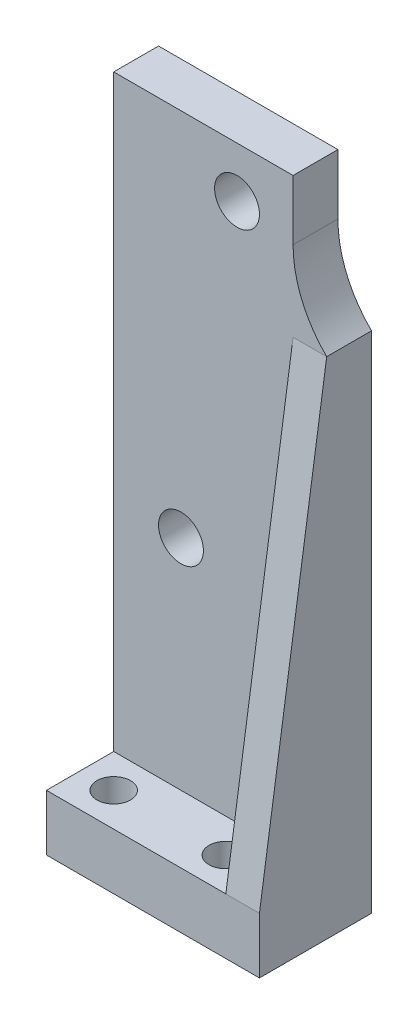
from build123d import *

# Parameters (mm, degrees)
SKETCH_1_W          = 16
SKETCH_1_H          = 6
SKETCH_1_R          = 1.5
EXTRUDE_1_DEPTH     = 5
SKETCH_2_W          = 16
SKETCH_2_H          = 57.5
EXTRUDE_2_DEPTH     = 4
SKETCH_3_R          = 2
CUT_EXTRUDE_1_DEPTH = 60.213596412
SKETCH_4_R          = 2
CUT_EXTRUDE_2_DEPTH = 60.213596412
SKETCH_5_R          = 3.5
CUT_EXTRUDE_3_DEPTH = 1
EXTRUDE_3_DEPTH     = 3
FILLET_1_R          = 10


with BuildPart() as part:
    # 草图1 → 凸台-拉伸1 (new body)
    with BuildSketch(Plane(origin=(0, 0, 0), x_dir=(1, 0, 0), z_dir=(0, 1, 0))):
        with Locations((2, 0)):
            Rectangle(SKETCH_1_W, SKETCH_1_H)
        with Locations(Location((-3, 0, 0), (0, 0, 270))):
            Circle(SKETCH_1_R, mode=Mode.SUBTRACT)
        with Locations(Location((7, 0, 0), (0, 0, 270))):
            Circle(SKETCH_1_R, mode=Mode.SUBTRACT)
    extrude(amount=EXTRUDE_1_DEPTH)

    # 草图2 → 凸台-拉伸2 (add)
    with BuildSketch(Plane(origin=(0, 0, -3), x_dir=(-1, 0, 0), z_dir=(0, 0, -1))):
        with Locations((-2, 28.75)):
            Rectangle(SKETCH_2_W, SKETCH_2_H)
    extrude(amount=EXTRUDE_2_DEPTH)

    # 草图3 → 切除-拉伸1 (cut, through all)
    with BuildSketch(Plane(origin=(0, 0, -7), x_dir=(-1, 0, 0), z_dir=(0, 0, -1))):
        with Locations((-5, 53)):
            Circle(SKETCH_3_R)
    extrude(amount=-CUT_EXTRUDE_1_DEPTH, mode=Mode.SUBTRACT)

    # 草图4 → 切除-拉伸2 (cut, through all)
    with BuildSketch(Plane(origin=(0, 0, -7), x_dir=(-1, 0, 0), z_dir=(0, 0, -1))):
        with Locations((0, 24.5)):
            Circle(SKETCH_4_R)
    extrude(amount=-CUT_EXTRUDE_2_DEPTH, mode=Mode.SUBTRACT)

    # 草图5 → 切除-拉伸3 (cut)
    with BuildSketch(Plane(origin=(0, 0, -7), x_dir=(-1, 0, 0), z_dir=(0, 0, -1))):
        with Locations((-5, 53)):
            Circle(SKETCH_5_R)
    extrude(amount=-CUT_EXTRUDE_3_DEPTH, mode=Mode.SUBTRACT)

    # 草图6 → 凸台-拉伸3 (add)
    with BuildSketch(Plane(origin=(10, 0, 0), x_dir=(0, 0, -1), z_dir=(1, 0, 0))):
        Polygon((3, 45), (3, 5), (-3, 5), (-3, 0), (7, 0), (7, 45), align=None)
        Polygon((-3, 5), (3, 5), (3, 45), align=None)
    extrude(amount=EXTRUDE_3_DEPTH)

    # 圆角1
    # the kernel refuses this fillet: 10 mm, written as the material it adds along each edge
    with BuildSketch(Plane(origin=(10, 45, -7), x_dir=(0, 1, 0), z_dir=(0, 0, 1))) as fillet_1_piece_1:
        with BuildLine():
            CenterArc((7.141428429, -10), FILLET_1_R, 90, 45.572995999)
            Line((0, -3), (0, 0))
            Line((0, 0), (7.141428429, 0))
        make_face()
    extrude(amount=4)


solid = part.part
